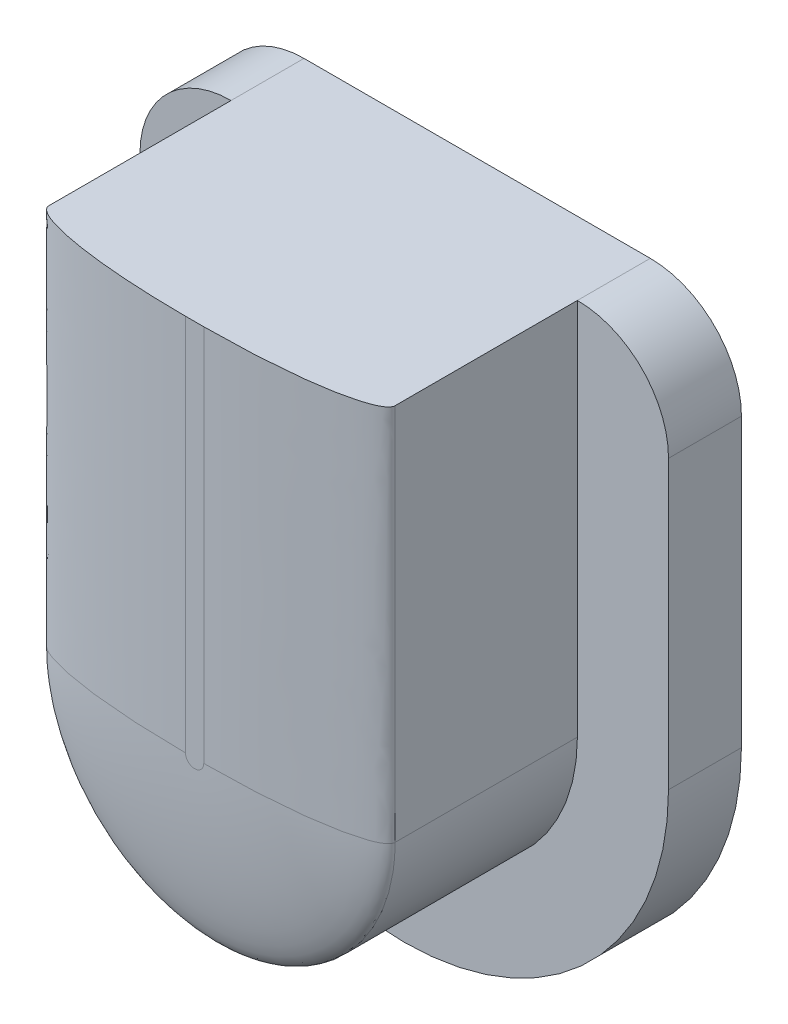
from build123d import *

# Parameters (mm, degrees)
EXTRUDE_1_DEPTH          = 3.1
EXTRUDE_2_DEPTH          = 0.8
FILLET_1_SIZE            = 0.3
FILLET_1_SIZE_2          = 1.8
SKETCH_3_R               = 1
SKETCH_3_R_2             = 1.096749421
EXTRUDE_3_DEPTH          = 1.05
FILLET_5_R               = 0.9
CUT_EXTRUDE_2_DEPTH      = 82.307539193
CUT_EXTRUDE_2_DEPTH_BACK = 82.307539193
SKETCH_7_W               = 5.8
SKETCH_7_H               = 24.900002621
FILLET_6_R               = 1


with BuildPart() as part:
    # 草图1 → 凸台-拉伸1 (new body)
    with BuildSketch(Plane.XY):
        with BuildLine():
            Line((-1.3, -78.273), (-1.3, -61.672998253))
            ThreePointArc((-1.3, -61.672998253), (0.6, -59.772998253), (2.5, -61.672998253))
            Line((2.5, -61.672998253), (2.5, -78.273))
            ThreePointArc((2.5, -78.273), (0.6, -80.173), (-1.3, -78.273))
        make_face()
    extrude(amount=EXTRUDE_1_DEPTH)

    # 草图2 → 凸台-拉伸2 (add)
    with BuildSketch(Plane(origin=(0, 0, 0), x_dir=(-1, 0, 0), z_dir=(0, 0, -1))):
        with BuildLine():
            Line((2.3, -78.273), (2.3, -61.672998253))
            ThreePointArc((2.3, -61.672998253), (-0.6, -58.772998253), (-3.5, -61.672998253))
            Line((-3.5, -61.672998253), (-3.5, -78.273))
            ThreePointArc((-3.5, -78.273), (-0.6, -81.173), (2.3, -78.273))
        make_face()
    extrude(amount=-EXTRUDE_2_DEPTH)

    # 圆角1
    # an asymmetric fillet: 1.8, 0.3 mm, written as the material it takes off along each edge
    with BuildSketch(Plane(origin=(2.5, -61.672998253, 3.1), x_dir=(0, 0, -1), z_dir=(0, -1, 0)), Plane(origin=(-1.3, -78.273, 3.1), x_dir=(0, 0, -1), z_dir=(0, 1, 0))) as fillet_1_piece_1:
        with BuildLine():
            Bezier((FILLET_1_SIZE, 0), (0, 0), (0, -FILLET_1_SIZE_2), weights=[1, 0.707106781, 1])
            Line((0, -FILLET_1_SIZE_2), (0, 0))
            Line((0, 0), (FILLET_1_SIZE, 0))
        make_face()
    extrude(amount=16.600001747, mode=Mode.SUBTRACT)
    with BuildSketch(Plane(origin=(0.6, -61.672998253, 3.1), x_dir=(-1, 0, 0), z_dir=(0, -1, 0))) as fillet_1_piece_2:
        with BuildLine():
            Bezier((1.9, FILLET_1_SIZE), (1.9, 0), (1.9 - FILLET_1_SIZE_2, 0), weights=[1, 0.707106781, 1])
            Line((1.9 - FILLET_1_SIZE_2, 0), (1.9, 0))
            Line((1.9, 0), (1.9, FILLET_1_SIZE))
        make_face()
    revolve(axis=Axis((0.6, -61.672998253, 3.1), (0, 0, -1)), revolution_arc=180, mode=Mode.SUBTRACT)
    with BuildSketch(Plane(origin=(0.6, -78.273, 3.1), x_dir=(1, 0, 0), z_dir=(0, 1, 0))) as fillet_1_piece_3:
        with BuildLine():
            Bezier((1.9, FILLET_1_SIZE), (1.9, 0), (1.9 - FILLET_1_SIZE_2, 0), weights=[1, 0.707106781, 1])
            Line((1.9 - FILLET_1_SIZE_2, 0), (1.9, 0))
            Line((1.9, 0), (1.9, FILLET_1_SIZE))
        make_face()
    revolve(axis=Axis((0.6, -78.273, 3.1), (0, 0, -1)), revolution_arc=180, mode=Mode.SUBTRACT)

    # 草图3 → 凸台-拉伸3 (add)
    with BuildSketch(Plane(origin=(0, 0, 0), x_dir=(-1, 0, 0), z_dir=(0, 0, -1))):
        with Locations(Location((-0.6, -61.672998253, 0), (0, 0, 180))):
            Circle(SKETCH_3_R)
        with Locations(Location((-0.6, -69.972999126, 0), (0, 0, 180))):
            Circle(SKETCH_3_R_2)
        with Locations(Location((-0.6, -78.273, 0), (0, 0, 180))):
            Circle(SKETCH_3_R_2)
    extrude(amount=EXTRUDE_3_DEPTH)

    # 圆角5
    fillet_5_edges = [part.edges().sort_by_distance(p)[0] for p in [
        (-0.4, -61.672998253, 0),
        (-0.496749421, -69.972999126, 0),
        (-0.496749421, -78.273, 0),
    ]]
    fillet(fillet_5_edges, radius=FILLET_5_R)

    # 草图7 → 切除-拉伸2 (cut, two sides: drawn at the far end of the back side and taken through both)
    with BuildSketch(Plane(origin=(0, 0, 0), x_dir=(-1, 0, 0), z_dir=(0, 0, -1)).offset(-CUT_EXTRUDE_2_DEPTH_BACK)):
        with Locations((-0.6, -61.672998253)):
            Rectangle(SKETCH_7_W, SKETCH_7_H)
    extrude(amount=CUT_EXTRUDE_2_DEPTH + CUT_EXTRUDE_2_DEPTH_BACK, mode=Mode.SUBTRACT)

    # 圆角6
    fillet_6_edges = [part.edges().sort_by_distance(p)[0] for p in [
        (-2.3, -74.122999563, 0.4),
        (3.5, -74.122999563, 0.4),
    ]]
    fillet(fillet_6_edges, radius=FILLET_6_R)


solid = part.part
